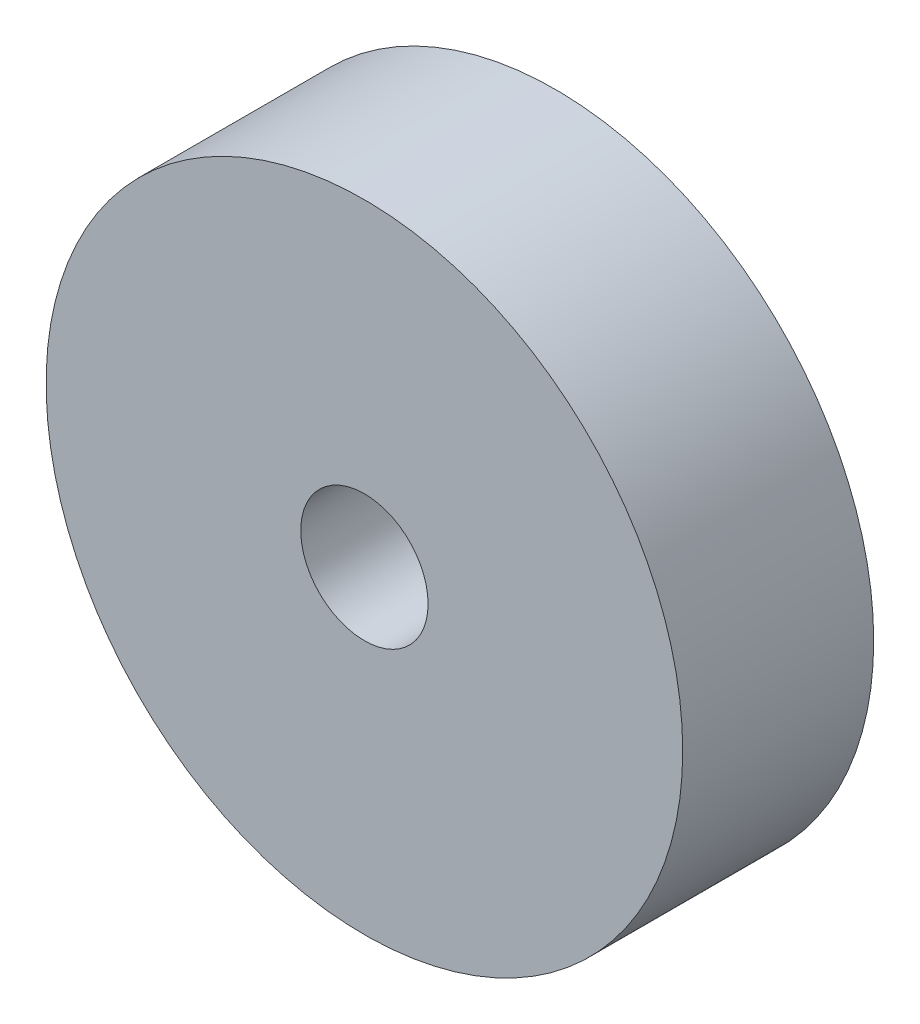
from build123d import *

# Parameters (mm, degrees)
SKETCH1_R           = 10
SKETCH1_R_2         = 2
BOSS_EXTRUDE1_DEPTH = 6


with BuildPart() as part:
    # Sketch1 → Boss-Extrude1 (new body)
    with BuildSketch(Plane.XY):
        Circle(SKETCH1_R)
        Circle(SKETCH1_R_2, mode=Mode.SUBTRACT)
    extrude(amount=BOSS_EXTRUDE1_DEPTH)


solid = part.part
